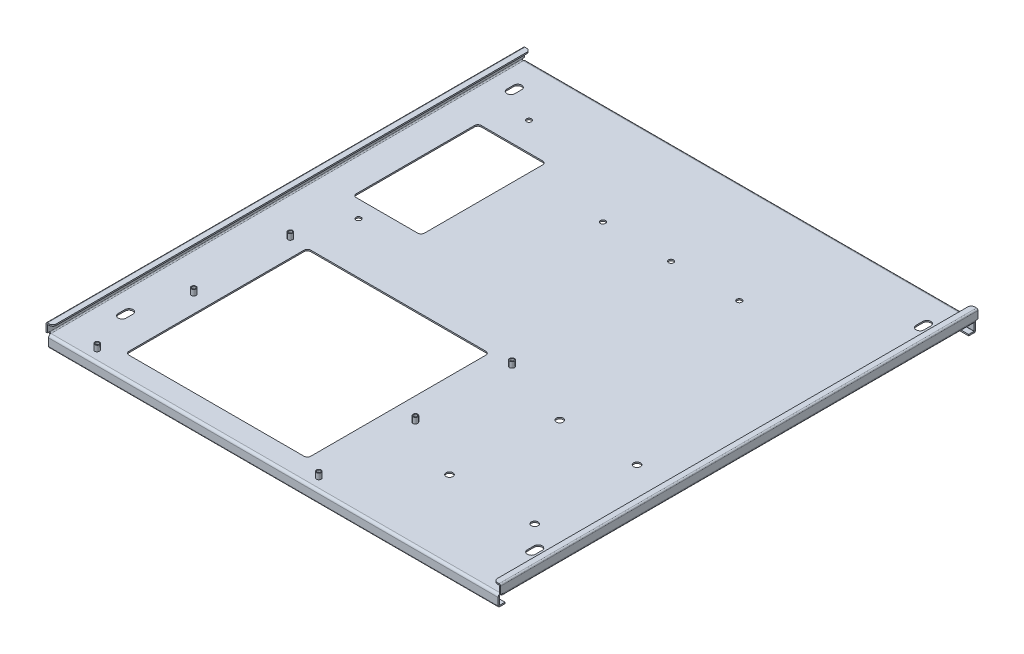
from build123d import *

# Parameters (mm, degrees)
SKETCH_1_W                         = 400
SKETCH_1_H                         = 420
SM_BASE_FLANGE_1_DEPTH             = 1.2
SM_EDGE_FLANGE_1_STRIP_W           = 6.8
SM_EDGE_FLANGE_1_STRIP_H           = 1.2
SM_EDGE_FLANGE_1_STRIP_CUT_DEPTH   = 420
SM_EDGE_FLANGE_1_STRIP_2_W         = 6.8
SM_EDGE_FLANGE_1_STRIP_2_H         = 1.2
SM_EDGE_FLANGE_1_STRIP_CUT_2_DEPTH = 420
SM_EDGE_FLANGE_1_DEPTH             = 420
SM_EDGE_FLANGE_1_BEND_DEPTH        = 420
SM_EDGE_FLANGE_2_STRIP_W           = 5
SM_EDGE_FLANGE_2_STRIP_H           = 1.2
SM_EDGE_FLANGE_2_STRIP_CUT_DEPTH   = 420
SM_EDGE_FLANGE_2_STRIP_2_W         = 5
SM_EDGE_FLANGE_2_STRIP_2_H         = 1.2
SM_EDGE_FLANGE_2_STRIP_CUT_2_DEPTH = 420
SM_EDGE_FLANGE_2_DEPTH             = 420
SM_EDGE_FLANGE_2_BEND_DEPTH        = 420
SM_START                           = -201
SM_EDGE_FLANGE_3_DEPTH             = 402
SM_EDGE_FLANGE_3_2_DEPTH           = 3.2
SM_START_2                         = 197.8
SM_EDGE_FLANGE_3_3_DEPTH           = 3.2
SM_START_3                         = -197.8
SM_EDGE_FLANGE_3_4_DEPTH           = 395.6
SM_EDGE_FLANGE_4_STRIP_W           = 5
SM_EDGE_FLANGE_4_STRIP_H           = 1.2
SM_EDGE_FLANGE_4_STRIP_CUT_DEPTH   = 395.6
SM_EDGE_FLANGE_4_STRIP_2_W         = 5
SM_EDGE_FLANGE_4_STRIP_2_H         = 1.2
SM_EDGE_FLANGE_4_STRIP_CUT_2_DEPTH = 395.6
SM_EDGE_FLANGE_4_DEPTH             = 395.6
SM_EDGE_FLANGE_4_BEND_DEPTH        = 395.6
FILLET_1_R                         = 3
SKETCH_40_R                        = 2.25
CUT_EXTRUDE_2_DEPTH                = 10
SKETCH_45_R                        = 1.5
CUT_EXTRUDE_3_DEPTH                = 3
SKETCH_48_R                        = 2.25
CUT_EXTRUDE_6_DEPTH                = 10
SKETCH_50_W                        = 60
SKETCH_50_H                        = 110
CUT_EXTRUDE_7_DEPTH                = 10
SKETCH_52_W                        = 160
SKETCH_52_H                        = 160
CUT_EXTRUDE_10_DEPTH               = 10
FILLET_2_R                         = 3
FILLET_4_R                         = 3
EXTRUDE_START                      = 5
SKETCH_54_R                        = 2.1
SKETCH_54_R_2                      = 1.5
EXTRUDE_1_DEPTH                    = 5
CUT_EXTRUDE_11_DEPTH               = 5
SKETCH_56_R                        = 3
CUT_EXTRUDE_12_DEPTH               = 10


with BuildPart() as part:
    # 基体-法兰1: sheet metal written as solids
    # Sketch 1 → 基体-法兰1 (new body)
    with BuildSketch(Plane(origin=(0, 0, 0), x_dir=(1, 0, 0), z_dir=(0, 1, 0))):
        Rectangle(SKETCH_1_W, SKETCH_1_H)
    extrude(amount=-SM_BASE_FLANGE_1_DEPTH)

    # 边线-法兰1: sheet metal written as solids
    # 边线-法兰1 strip (on a plane across the edge) → 边线-法兰1 strip cut (cut)
    with BuildSketch(Plane(origin=(-200, 0, -210), x_dir=(1, 0, 0), z_dir=(0, 0, 1))):
        with Locations((-1.2, -0.6)):
            Rectangle(SM_EDGE_FLANGE_1_STRIP_W, SM_EDGE_FLANGE_1_STRIP_H)
    extrude(amount=SM_EDGE_FLANGE_1_STRIP_CUT_DEPTH, mode=Mode.SUBTRACT)

    # 边线-法兰1 strip 2 (on a plane across the edge) → 边线-法兰1 strip cut 2 (cut)
    with BuildSketch(Plane(origin=(200, 0, 210), x_dir=(-1, 0, 0), z_dir=(0, 0, -1))):
        with Locations((-1.2, -0.6)):
            Rectangle(SM_EDGE_FLANGE_1_STRIP_2_W, SM_EDGE_FLANGE_1_STRIP_2_H)
    extrude(amount=SM_EDGE_FLANGE_1_STRIP_CUT_2_DEPTH, mode=Mode.SUBTRACT)

    # 边线-法兰1 section (on a plane across the edge) → 边线-法兰1 (add)
    with BuildSketch(Plane(origin=(-200, 0, -210), x_dir=(1, 0, 0), z_dir=(0, 0, 1))):
        with BuildLine():
            Line((0, 1), (0, 8.8))
            Line((0, 8.8), (1.2, 8.8))
            Line((1.2, 8.8), (1.2, 1))
            ThreePointArc((1.2, 1), (1.492893219, 0.292893219), (2.2, 0))
            Line((2.2, 0), (2.2, -1.2))
            ThreePointArc((2.2, -1.2), (0.644365081, -0.555634919), (0, 1))
        make_face()
    extrude(amount=SM_EDGE_FLANGE_1_DEPTH)

    # 边线-法兰1 section 2 (on a plane across the edge) → 边线-法兰1 bend (add)
    with BuildSketch(Plane(origin=(200, 0, 210), x_dir=(-1, 0, 0), z_dir=(0, 0, -1))):
        with BuildLine():
            Line((0, 1), (0, 8.8))
            Line((0, 8.8), (1.2, 8.8))
            Line((1.2, 8.8), (1.2, 1))
            ThreePointArc((1.2, 1), (1.492893219, 0.292893219), (2.2, 0))
            Line((2.2, 0), (2.2, -1.2))
            ThreePointArc((2.2, -1.2), (0.644365081, -0.555634919), (0, 1))
        make_face()
    extrude(amount=SM_EDGE_FLANGE_1_BEND_DEPTH)

    # 边线-法兰2: sheet metal written as solids
    # 边线-法兰2 strip (on a plane across the edge) → 边线-法兰2 strip cut (cut)
    with BuildSketch(Plane(origin=(-198.8, 8.8, -210), x_dir=(0, -1, 0), z_dir=(0, 0, 1))):
        with Locations((-1.2, -0.6)):
            Rectangle(SM_EDGE_FLANGE_2_STRIP_W, SM_EDGE_FLANGE_2_STRIP_H)
    extrude(amount=SM_EDGE_FLANGE_2_STRIP_CUT_DEPTH, mode=Mode.SUBTRACT)

    # 边线-法兰2 strip 2 (on a plane across the edge) → 边线-法兰2 strip cut 2 (cut)
    with BuildSketch(Plane(origin=(198.8, 8.8, 210), x_dir=(0, -1, 0), z_dir=(0, 0, -1))):
        with Locations((-1.2, -0.6)):
            Rectangle(SM_EDGE_FLANGE_2_STRIP_2_W, SM_EDGE_FLANGE_2_STRIP_2_H)
    extrude(amount=SM_EDGE_FLANGE_2_STRIP_CUT_2_DEPTH, mode=Mode.SUBTRACT)

    # 边线-法兰2 section (on a plane across the edge) → 边线-法兰2 (add)
    with BuildSketch(Plane(origin=(-198.8, 8.8, -210), x_dir=(0, -1, 0), z_dir=(0, 0, 1))):
        with BuildLine():
            Line((0, 0.1), (0, 4.8))
            Line((0, 4.8), (1.2, 4.8))
            Line((1.2, 4.8), (1.2, 0.1))
            ThreePointArc((1.2, 0.1), (1.229289322, 0.029289322), (1.3, 0))
            Line((1.3, 0), (1.3, -1.2))
            ThreePointArc((1.3, -1.2), (0.380761184, -0.819238816), (0, 0.1))
        make_face()
    extrude(amount=SM_EDGE_FLANGE_2_DEPTH)

    # 边线-法兰2 section 2 (on a plane across the edge) → 边线-法兰2 bend (add)
    with BuildSketch(Plane(origin=(198.8, 8.8, 210), x_dir=(0, -1, 0), z_dir=(0, 0, -1))):
        with BuildLine():
            Line((0, 0.1), (0, 4.8))
            Line((0, 4.8), (1.2, 4.8))
            Line((1.2, 4.8), (1.2, 0.1))
            ThreePointArc((1.2, 0.1), (1.229289322, 0.029289322), (1.3, 0))
            Line((1.3, 0), (1.3, -1.2))
            ThreePointArc((1.3, -1.2), (0.380761184, -0.819238816), (0, 0.1))
        make_face()
    extrude(amount=SM_EDGE_FLANGE_2_BEND_DEPTH)

    # 边线-法兰3: read off the stored shape, not the designer's step
    # 边线-法兰3 outline → 边线-法兰3 (cut)
    with BuildSketch(Plane.YZ.offset(SM_START)):
        with BuildLine():
            Line((1, -210), (1, -207.8))
            Line((1, -207.8), (0, -207.8))
            ThreePointArc((0, -207.8), (-0.323833696, -208.94891253), (-1.2, -209.759591795))
            Line((-1.2, -209.759591795), (-1.2, -210))
            Line((-1.2, -210), (1, -210))
        make_face()
        with BuildLine():
            Line((1, 210), (-1.2, 210))
            Line((-1.2, 210), (-1.2, 209.759591795))
            ThreePointArc((-1.2, 209.759591795), (-0.323833696, 208.94891253), (0, 207.8))
            Line((0, 207.8), (1, 207.8))
            Line((1, 207.8), (1, 210))
        make_face()
    extrude(amount=SM_EDGE_FLANGE_3_DEPTH, mode=Mode.SUBTRACT)

    # Sm Edge Flange 3 2 outline → Sm Edge Flange 3 2 (cut)
    with BuildSketch(Plane.YZ.offset(SM_START)):
        with BuildLine():
            ThreePointArc((-1.2, -209.759591795), (-0.323833696, -208.94891253), (0, -207.8))
            Line((0, -207.8), (-1.2, -207.8))
            Line((-1.2, -207.8), (-1.2, -209.759591795))
        make_face()
        with BuildLine():
            Line((-1.2, 207.8), (0, 207.8))
            ThreePointArc((0, 207.8), (-0.323833696, 208.94891253), (-1.2, 209.759591795))
            Line((-1.2, 209.759591795), (-1.2, 207.8))
        make_face()
    extrude(amount=SM_EDGE_FLANGE_3_2_DEPTH, mode=Mode.SUBTRACT)

    # Sm Edge Flange 3 3 outline → Sm Edge Flange 3 3 (cut)
    with BuildSketch(Plane.YZ.offset(SM_START_2)):
        with BuildLine():
            ThreePointArc((-1.2, -209.759591795), (-0.323833696, -208.94891253), (0, -207.8))
            Line((0, -207.8), (-1.2, -207.8))
            Line((-1.2, -207.8), (-1.2, -209.759591795))
        make_face()
        with BuildLine():
            Line((-1.2, 207.8), (0, 207.8))
            ThreePointArc((0, 207.8), (-0.323833696, 208.94891253), (-1.2, 209.759591795))
            Line((-1.2, 209.759591795), (-1.2, 207.8))
        make_face()
    extrude(amount=SM_EDGE_FLANGE_3_3_DEPTH, mode=Mode.SUBTRACT)

    # Sm Edge Flange 3 4 outline → Sm Edge Flange 3 4 (add)
    with BuildSketch(Plane.YZ.offset(SM_START_3)):
        with BuildLine():
            Line((-1.2, -209.759591795), (-1.2, -207.8))
            ThreePointArc((-1.2, -207.8), (-1.492893219, -208.507106781), (-2.2, -208.8))
            Line((-2.2, -208.8), (-10, -208.8))
            Line((-10, -208.8), (-10, -210))
            Line((-10, -210), (-2.2, -210))
            ThreePointArc((-2.2, -210), (-1.685753924, -209.939053757), (-1.2, -209.759591795))
        make_face()
        with BuildLine():
            ThreePointArc((-2.2, 208.8), (-1.492893219, 208.507106781), (-1.2, 207.8))
            Line((-1.2, 207.8), (-1.2, 209.759591795))
            ThreePointArc((-1.2, 209.759591795), (-1.685753924, 209.939053757), (-2.2, 210))
            Line((-2.2, 210), (-10, 210))
            Line((-10, 210), (-10, 208.8))
            Line((-10, 208.8), (-2.2, 208.8))
        make_face()
    extrude(amount=SM_EDGE_FLANGE_3_4_DEPTH)

    # 边线-法兰4: sheet metal written as solids
    # 边线-法兰4 strip (on a plane across the edge) → 边线-法兰4 strip cut (cut)
    with BuildSketch(Plane(origin=(-197.8, -10, -208.8), x_dir=(0, 1, 0), z_dir=(1, 0, 0))):
        with Locations((-1.2, -0.6)):
            Rectangle(SM_EDGE_FLANGE_4_STRIP_W, SM_EDGE_FLANGE_4_STRIP_H)
    extrude(amount=SM_EDGE_FLANGE_4_STRIP_CUT_DEPTH, mode=Mode.SUBTRACT)

    # 边线-法兰4 strip 2 (on a plane across the edge) → 边线-法兰4 strip cut 2 (cut)
    with BuildSketch(Plane(origin=(197.8, -10, 208.8), x_dir=(0, 1, 0), z_dir=(-1, 0, 0))):
        with Locations((-1.2, -0.6)):
            Rectangle(SM_EDGE_FLANGE_4_STRIP_2_W, SM_EDGE_FLANGE_4_STRIP_2_H)
    extrude(amount=SM_EDGE_FLANGE_4_STRIP_CUT_2_DEPTH, mode=Mode.SUBTRACT)

    # 边线-法兰4 section (on a plane across the edge) → 边线-法兰4 (add)
    with BuildSketch(Plane(origin=(-197.8, -10, -208.8), x_dir=(0, 1, 0), z_dir=(1, 0, 0))):
        with BuildLine():
            Line((0, 0.1), (0, 4.8))
            Line((0, 4.8), (1.2, 4.8))
            Line((1.2, 4.8), (1.2, 0.1))
            ThreePointArc((1.2, 0.1), (1.229289322, 0.029289322), (1.3, 0))
            Line((1.3, 0), (1.3, -1.2))
            ThreePointArc((1.3, -1.2), (0.380761184, -0.819238816), (0, 0.1))
        make_face()
    extrude(amount=SM_EDGE_FLANGE_4_DEPTH)

    # 边线-法兰4 section 2 (on a plane across the edge) → 边线-法兰4 bend (add)
    with BuildSketch(Plane(origin=(197.8, -10, 208.8), x_dir=(0, 1, 0), z_dir=(-1, 0, 0))):
        with BuildLine():
            Line((0, 0.1), (0, 4.8))
            Line((0, 4.8), (1.2, 4.8))
            Line((1.2, 4.8), (1.2, 0.1))
            ThreePointArc((1.2, 0.1), (1.229289322, 0.029289322), (1.3, 0))
            Line((1.3, 0), (1.3, -1.2))
            ThreePointArc((1.3, -1.2), (0.380761184, -0.819238816), (0, 0.1))
        make_face()
    extrude(amount=SM_EDGE_FLANGE_4_BEND_DEPTH)

    # 圆角1
    fillet_1_edges = [part.edges().sort_by_distance(p)[0] for p in [
        (-194, 8.2, -210),
        (-194, 8.2, 210),
        (194, 8.2, 210),
        (194, 8.2, -210),
    ]]
    fillet(fillet_1_edges, radius=FILLET_1_R)

    # 草图40 → 切除-拉伸2 (cut)
    with BuildSketch(Plane(origin=(0, 0, 0), x_dir=(1, 0, 0), z_dir=(0, 1, 0))):
        with Locations(Location((-40, 120, 0), (0, 0, 270))):
            Circle(SKETCH_40_R)
        with Locations(Location((20, 120, 0), (0, 0, 270))):
            Circle(SKETCH_40_R)
        with Locations(Location((80, 120, 0), (0, 0, 270))):
            Circle(SKETCH_40_R)
    extrude(amount=-CUT_EXTRUDE_2_DEPTH, mode=Mode.SUBTRACT)

    # 草图45 → 切除-拉伸3 (cut)
    with BuildSketch(Plane(origin=(0, 0, 0), x_dir=(1, 0, 0), z_dir=(0, 1, 0))):
        with Locations(Location((-165, -30, 0), (0, 0, 270))):
            Circle(SKETCH_45_R)
        with Locations(Location((30, -200, 0), (0, 0, 270))):
            Circle(SKETCH_45_R)
        with Locations(Location((-165, -200, 0), (0, 0, 270))):
            Circle(SKETCH_45_R)
        with Locations(Location((30, -30, 0), (0, 0, 270))):
            Circle(SKETCH_45_R)
        with Locations(Location((-165, -115, 0), (0, 0, 270))):
            Circle(SKETCH_45_R)
        with Locations(Location((30, -115, 0), (0, 0, 270))):
            Circle(SKETCH_45_R)
    extrude(amount=-CUT_EXTRUDE_3_DEPTH, mode=Mode.SUBTRACT)

    # 草图48 → 切除-拉伸6 (cut)
    with BuildSketch(Plane(origin=(0, 0, 0), x_dir=(1, 0, 0), z_dir=(0, 1, 0))):
        with Locations(Location((-150, 165, 0), (0, 0, 270))):
            Circle(SKETCH_48_R)
        with Locations(Location((-150, 15, 0), (0, 0, 270))):
            Circle(SKETCH_48_R)
    extrude(amount=-CUT_EXTRUDE_6_DEPTH, mode=Mode.SUBTRACT)

    # 草图50 → 切除-拉伸7 (cut)
    with BuildSketch(Plane(origin=(0, 0, 0), x_dir=(1, 0, 0), z_dir=(0, 1, 0))):
        with Locations((-140, 85)):
            Rectangle(SKETCH_50_W, SKETCH_50_H)
    extrude(amount=-CUT_EXTRUDE_7_DEPTH, mode=Mode.SUBTRACT)

    # 草图52 → 切除-拉伸10 (cut)
    with BuildSketch(Plane(origin=(0, 0, 0), x_dir=(1, 0, 0), z_dir=(0, 1, 0))):
        with Locations((-70, -110)):
            Rectangle(SKETCH_52_W, SKETCH_52_H)
    extrude(amount=-CUT_EXTRUDE_10_DEPTH, mode=Mode.SUBTRACT)

    # 圆角2
    fillet_2_edges = [part.edges().sort_by_distance(p)[0] for p in [
        (-170, -0.6, -30),
        (-170, -0.6, -140),
        (-110, -0.6, -140),
        (-110, -0.6, -30),
    ]]
    fillet(fillet_2_edges, radius=FILLET_2_R)

    # 圆角4
    fillet_4_edges = [part.edges().sort_by_distance(p)[0] for p in [
        (-150, -0.6, 190),
        (-150, -0.6, 30),
        (10, -0.6, 30),
        (10, -0.6, 190),
    ]]
    fillet(fillet_4_edges, radius=FILLET_4_R)

    # 草图54 → 凸台-拉伸1 (add)
    # profile 1 of 6: a face of its own
    with BuildSketch(Plane(origin=(0, 0, 0), x_dir=(1, 0, 0), z_dir=(0, 1, 0)).offset(EXTRUDE_START)):
        with Locations(Location((30, -30, 0), (0, 0, 270))):
            Circle(SKETCH_54_R)
        with Locations(Location((30, -30, 0), (0, 0, 270))):
            Circle(SKETCH_54_R_2, mode=Mode.SUBTRACT)
    # profile 2 of 6: a face of its own
    with BuildSketch(Plane(origin=(0, 0, 0), x_dir=(1, 0, 0), z_dir=(0, 1, 0)).offset(EXTRUDE_START)):
        with Locations(Location((-165, -30, 0), (0, 0, 270))):
            Circle(SKETCH_54_R)
        with Locations(Location((-165, -30, 0), (0, 0, 270))):
            Circle(SKETCH_54_R_2, mode=Mode.SUBTRACT)
    # profile 3 of 6: a face of its own
    with BuildSketch(Plane(origin=(0, 0, 0), x_dir=(1, 0, 0), z_dir=(0, 1, 0)).offset(EXTRUDE_START)):
        with Locations(Location((-165, -115, 0), (0, 0, 270))):
            Circle(SKETCH_54_R)
        with Locations(Location((-165, -115, 0), (0, 0, 270))):
            Circle(SKETCH_54_R_2, mode=Mode.SUBTRACT)
    # profile 4 of 6: a face of its own
    with BuildSketch(Plane(origin=(0, 0, 0), x_dir=(1, 0, 0), z_dir=(0, 1, 0)).offset(EXTRUDE_START)):
        with Locations(Location((-165, -200, 0), (0, 0, 270))):
            Circle(SKETCH_54_R)
        with Locations(Location((-165, -200, 0), (0, 0, 270))):
            Circle(SKETCH_54_R_2, mode=Mode.SUBTRACT)
    # profile 5 of 6: a face of its own
    with BuildSketch(Plane(origin=(0, 0, 0), x_dir=(1, 0, 0), z_dir=(0, 1, 0)).offset(EXTRUDE_START)):
        with Locations(Location((30, -115, 0), (0, 0, 270))):
            Circle(SKETCH_54_R)
        with Locations(Location((30, -115, 0), (0, 0, 270))):
            Circle(SKETCH_54_R_2, mode=Mode.SUBTRACT)
    # profile 6 of 6: a face of its own
    with BuildSketch(Plane(origin=(0, 0, 0), x_dir=(1, 0, 0), z_dir=(0, 1, 0)).offset(EXTRUDE_START)):
        with Locations(Location((30, -200, 0), (0, 0, 270))):
            Circle(SKETCH_54_R)
        with Locations(Location((30, -200, 0), (0, 0, 270))):
            Circle(SKETCH_54_R_2, mode=Mode.SUBTRACT)
    extrude(amount=-EXTRUDE_1_DEPTH)

    # 草图55 → 切除-拉伸11 (cut)
    with BuildSketch(Plane(origin=(0, 0, 0), x_dir=(1, 0, 0), z_dir=(0, 1, 0))):
        with BuildLine():
            Line((176.5, -163), (176.5, -157))
            ThreePointArc((176.5, -157), (180, -153.5), (183.5, -157))
            Line((183.5, -157), (183.5, -163))
            ThreePointArc((183.5, -163), (180, -166.5), (176.5, -163))
        make_face()
        with BuildLine():
            Line((176.5, 179), (176.5, 185))
            ThreePointArc((176.5, 185), (180, 188.5), (183.5, 185))
            Line((183.5, 185), (183.5, 179))
            ThreePointArc((183.5, 179), (180, 175.5), (176.5, 179))
        make_face()
        with BuildLine():
            Line((-176.5, 179), (-176.5, 185))
            ThreePointArc((-176.5, 185), (-180, 188.5), (-183.5, 185))
            Line((-183.5, 185), (-183.5, 179))
            ThreePointArc((-183.5, 179), (-180, 175.5), (-176.5, 179))
        make_face()
        with BuildLine():
            Line((-176.5, -163), (-176.5, -157))
            ThreePointArc((-176.5, -157), (-180, -153.5), (-183.5, -157))
            Line((-183.5, -157), (-183.5, -163))
            ThreePointArc((-183.5, -163), (-180, -166.5), (-176.5, -163))
        make_face()
    extrude(amount=-CUT_EXTRUDE_11_DEPTH, mode=Mode.SUBTRACT)

    # 草图56 → 切除-拉伸12 (cut)
    with BuildSketch(Plane(origin=(0, 0, 0), x_dir=(1, 0, 0), z_dir=(0, 1, 0))):
        with Locations(Location((160, -50, 0), (0, 0, 270))):
            Circle(SKETCH_56_R)
        with Locations(Location((92, -50, 0), (0, 0, 270))):
            Circle(SKETCH_56_R)
        with Locations(Location((160, -140, 0), (0, 0, 270))):
            Circle(SKETCH_56_R)
        with Locations(Location((85, -140, 0), (0, 0, 270))):
            Circle(SKETCH_56_R)
    extrude(amount=-CUT_EXTRUDE_12_DEPTH, mode=Mode.SUBTRACT)


solid = part.part
